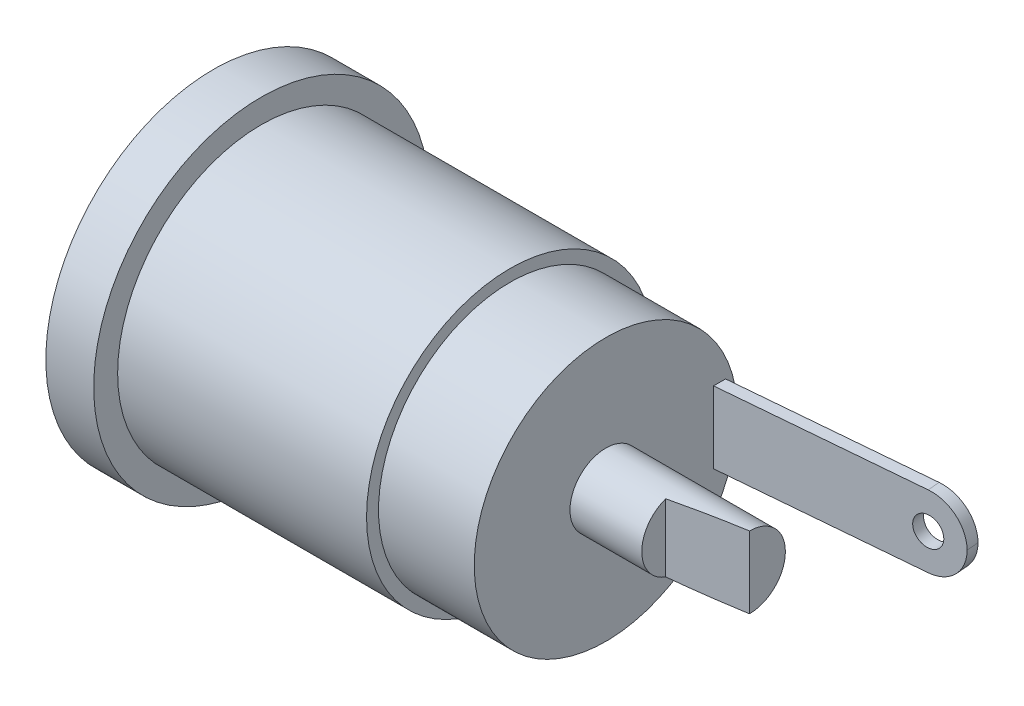
from build123d import *

# Parameters (mm, degrees)
SKETCH2_R               = 2.85
CUT_EXTRUDE1_DEPTH      = 10
CHAMFER1_SIZE           = 1
SKETCH4_R               = 1.5
BOSS_EXTRUDE1_DEPTH     = 6
CUT_EXTRUDE2_DEPTH      = 25.489997958
CUT_EXTRUDE2_DEPTH_BACK = 25.489997958
BOSS_EXTRUDE2_DEPTH     = 1.5
FILLET1_R               = 1.5
SKETCH7_R               = 0.6
CUT_EXTRUDE3_DEPTH      = 3


with BuildPart() as part:
    # Sketch1 → Revolve1 (revolve)
    with BuildSketch(Plane(origin=(0, 0, 0), x_dir=(1, 0, 0), z_dir=(0, 1, 0))):
        Polygon((0, 0), (0, 7), (2, 7), (2, 6), (12.4, 6), (12.4, 5.5), (16.4, 5.5), (16.4, 0), align=None)
    revolve(axis=Axis((16.4, 0, 0), (-1, 0, 0)))

    # Sketch2 → Cut-Extrude1 (cut)
    with BuildSketch(Plane.ZY):
        Circle(SKETCH2_R)
    extrude(amount=-CUT_EXTRUDE1_DEPTH, mode=Mode.SUBTRACT)

    # Chamfer1
    chamfer1_edges = [part.edges().sort_by_distance(p)[0] for p in [
        (0, 0, -2.85),
    ]]
    chamfer(chamfer1_edges, length=CHAMFER1_SIZE)

    # Sketch4 → Boss-Extrude1 (add)
    with BuildSketch(Plane(origin=(16.4, 0, 0), x_dir=(0, 0, -1), z_dir=(1, 0, 0))):
        Circle(SKETCH4_R)
    extrude(amount=BOSS_EXTRUDE1_DEPTH)

    # Sketch5 → Cut-Extrude2 (cut, two sides: drawn at the far end of the back side and taken through both)
    with BuildSketch(Plane(origin=(0, 0, 0), x_dir=(1, 0, 0), z_dir=(0, 1, 0)).offset(-CUT_EXTRUDE2_DEPTH_BACK)):
        Polygon((22.4, -1.5), (19.4, -1.5), (19.4, -0.5), (22.4, 0), align=None)
    extrude(amount=CUT_EXTRUDE2_DEPTH + CUT_EXTRUDE2_DEPTH_BACK, mode=Mode.SUBTRACT)

    # Sketch6 → Boss-Extrude2 (add, symmetric)
    with BuildSketch(Plane(origin=(0, 0, 0), x_dir=(1, 0, 0), z_dir=(0, 1, 0))):
        Polygon((16.4, 5), (26.1, 5.848640036), (26.143577871, 5.350542687), (16.4, 4.498090081), align=None)
    extrude(amount=BOSS_EXTRUDE2_DEPTH, both=True)

    # Fillet1
    fillet1_edges = [part.edges().sort_by_distance(p)[0] for p in [
        (26.121788936, 1.5, -5.599591362),
        (26.121788936, -1.5, -5.599591362),
    ]]
    fillet(fillet1_edges, radius=FILLET1_R - 0.0001)  # a hair under: the kernel refuses the full size

    # Sketch7 → Cut-Extrude3 (cut)
    with BuildSketch(Plane(origin=(-0.309544019, 0, -3.538104326), x_dir=(-0.9961946980917462, 0, 0.08715574274765167), z_dir=(-0.08715574274765167, 0, -0.9961946980917462))):
        with Locations((-25.010424187, 0)):
            Circle(SKETCH7_R)
    extrude(amount=-CUT_EXTRUDE3_DEPTH, mode=Mode.SUBTRACT)


solid = part.part
